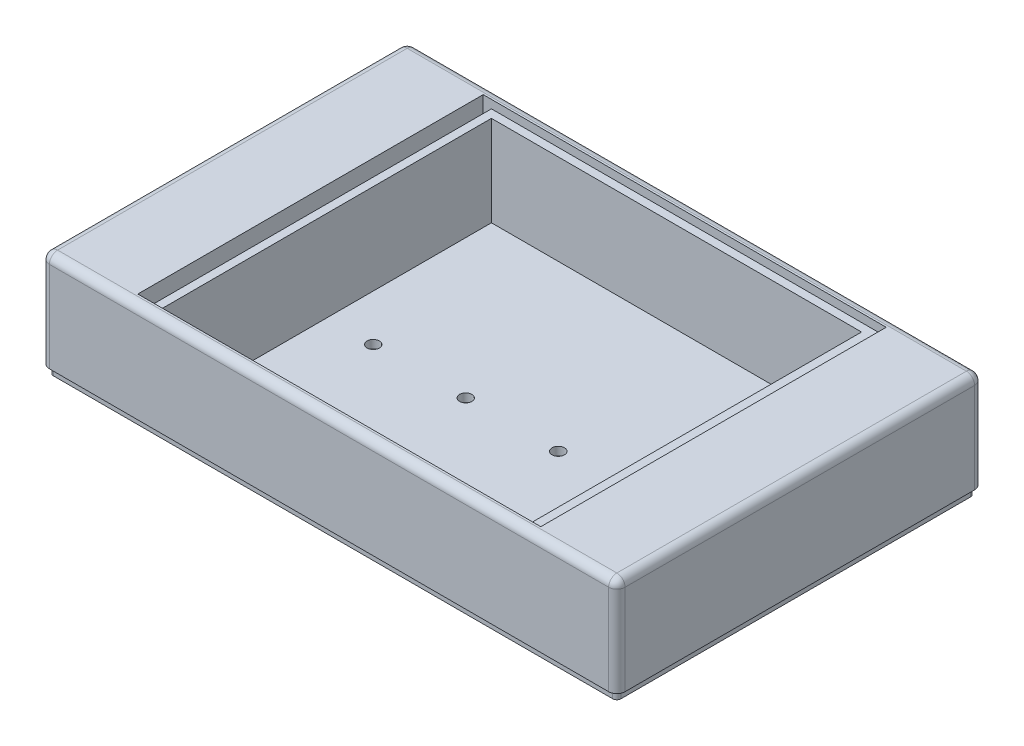
from build123d import *

# Parameters (mm, degrees)
BOSS_EXTRUDE1_DEPTH      = 16
BOSS_EXTRUDE1_DEPTH_BACK = 10
SKETCH1_W                = 140
SKETCH1_H                = 89
SKETCH2_W                = 94
SKETCH2_H                = 84
BOSS_EXTRUDE2_DEPTH      = 22
SKETCH3_W                = 90
SKETCH3_H                = 80
CUT_EXTRUDE2_DEPTH       = 24
SKETCH5_R                = 1.5
CUT_EXTRUDE4_DEPTH       = 2
FILLET1_R                = 2
FILLET2_R                = 2
CUT_EXTRUDE8_DEPTH       = 2
SKETCH10_W               = 5
SKETCH10_H               = 3
CUT_EXTRUDE9_DEPTH       = 3
SKETCH11_W               = 2
SKETCH11_H               = 84
CUT_EXTRUDE10_DEPTH      = 2
SHELL1_START             = -68
SHELL1_OUTLINE_W         = 20
SHELL1_OUTLINE_H         = 81
SHELL1_DEPTH             = 21
SHELL1_START_2           = 47
SHELL1_2_OUTLINE_W       = 20
SHELL1_2_OUTLINE_H       = 81
SHELL1_2_DEPTH           = 21
SHELL1_3_OUTLINE_W       = 4
SHELL1_3_OUTLINE_H       = 81
SHELL1_3_DEPTH           = 17
SHELL1_START_3           = 51
SHELL1_4_OUTLINE_W       = 4
SHELL1_4_OUTLINE_H       = 81
SHELL1_4_DEPTH           = 17
SKETCH7_OUTSIDE_W        = 175.584
SKETCH7_OUTSIDE_H        = 124.584
CUT_EXTRUDE6_DEPTH       = 2


# Read off the part's stored shape, not the designer's step: Shell1
with BuildPart() as part:
    # Sketch1 → Boss-Extrude1 (new, two sides: drawn at the far end of the back side and taken through both)
    with BuildSketch(Plane(origin=(0, 0, 0), x_dir=(1, 0, 0), z_dir=(0, 1, 0)).offset(-BOSS_EXTRUDE1_DEPTH_BACK)):
        Rectangle(SKETCH1_W, SKETCH1_H)
    extrude(amount=BOSS_EXTRUDE1_DEPTH + BOSS_EXTRUDE1_DEPTH_BACK)

    # Sketch2 → Boss-Extrude2 (add)
    with BuildSketch(Plane(origin=(0, 16, 0), x_dir=(1, 0, 0), z_dir=(0, 1, 0))):
        Rectangle(SKETCH2_W, SKETCH2_H)
    extrude(amount=-BOSS_EXTRUDE2_DEPTH)

    # Sketch3 → Cut-Extrude2 (cut)
    with BuildSketch(Plane(origin=(0, 16, 0), x_dir=(1, 0, 0), z_dir=(0, 1, 0))):
        Rectangle(SKETCH3_W, SKETCH3_H)
    extrude(amount=-CUT_EXTRUDE2_DEPTH, mode=Mode.SUBTRACT)

    # Sketch5 → Cut-Extrude4 (cut)
    with BuildSketch(Plane(origin=(0, -8, 0), x_dir=(1, 0, 0), z_dir=(0, 1, 0))):
        with Locations(Location((-33.75, 0, 0), (0, 0, 270))):
            Circle(SKETCH5_R)
        with Locations(Location((-11.25, 0, 0), (0, 0, 270))):
            Circle(SKETCH5_R)
        with Locations(Location((11.25, 0, 0), (0, 0, 270))):
            Circle(SKETCH5_R)
        with Locations(Location((33.75, 0, 0), (0, 0, 270))):
            Circle(SKETCH5_R)
    extrude(amount=-CUT_EXTRUDE4_DEPTH, mode=Mode.SUBTRACT)

    # Fillet1
    fillet1_edges = [part.edges().sort_by_distance(p)[0] for p in [
        (70, 3, 44.5),
        (-70, 3, 44.5),
        (-70, 3, -44.5),
        (70, 3, -44.5),
    ]]
    fillet(fillet1_edges, radius=FILLET1_R)

    # Fillet2
    fillet2_edges = [part.edges().sort_by_distance(p)[0] for p in [
        (-70, 16, 0),
        (70, 16, 0),
        (0, 16, -44.5),
        (0, 16, 44.5),
        (69.414213562, 16, 43.914213562),
        (69.414213562, 16, -43.914213562),
        (-69.414213562, 16, -43.914213562),
        (-69.414213562, 16, 43.914213562),
    ]]
    fillet(fillet2_edges, radius=FILLET2_R)

    # Sketch8 → Cut-Extrude8 (cut)
    with BuildSketch(Plane(origin=(0, 16, 0), x_dir=(1, 0, 0), z_dir=(0, 1, 0))):
        Polygon((-47, 42), (-49, 42), (-49, -42), (-47, -42), (47, -42), (49, -42), (49, 42), (47, 42), align=None)
    extrude(amount=-CUT_EXTRUDE8_DEPTH, mode=Mode.SUBTRACT)

    # Sketch10 → Cut-Extrude9 (cut)
    with BuildSketch(Plane(origin=(0, 0, 40), x_dir=(-1, 0, 0), z_dir=(0, 0, -1))):
        with Locations((-22.5, 10.5)):
            Rectangle(SKETCH10_W, SKETCH10_H)
        with Locations((22.5, 10.5)):
            Rectangle(SKETCH10_W, SKETCH10_H)
    extrude(amount=-CUT_EXTRUDE9_DEPTH, mode=Mode.SUBTRACT)

    # Sketch11 → Cut-Extrude10 (cut)
    with BuildSketch(Plane(origin=(0, 14, 0), x_dir=(1, 0, 0), z_dir=(0, 1, 0))):
        with Locations((-48, 0)):
            Rectangle(SKETCH11_W, SKETCH11_H)
        with Locations((48, 0)):
            Rectangle(SKETCH11_W, SKETCH11_H)
    extrude(amount=-CUT_EXTRUDE10_DEPTH, mode=Mode.SUBTRACT)

    # Shell1 outline → Shell1 (cut)
    with BuildSketch(Plane.YZ.offset(SHELL1_START)):
        Rectangle(SHELL1_OUTLINE_W, SHELL1_OUTLINE_H)
    extrude(amount=SHELL1_DEPTH, mode=Mode.SUBTRACT)

    # Shell1 2 outline → Shell1 2 (cut)
    with BuildSketch(Plane.YZ.offset(SHELL1_START_2)):
        Rectangle(SHELL1_2_OUTLINE_W, SHELL1_2_OUTLINE_H)
    extrude(amount=SHELL1_2_DEPTH, mode=Mode.SUBTRACT)

    # Shell1 3 outline → Shell1 3 (cut)
    with BuildSketch(Plane.YZ.offset(SHELL1_START)):
        with Locations((12, 0)):
            Rectangle(SHELL1_3_OUTLINE_W, SHELL1_3_OUTLINE_H)
    extrude(amount=SHELL1_3_DEPTH, mode=Mode.SUBTRACT)

    # Shell1 4 outline → Shell1 4 (cut)
    with BuildSketch(Plane.YZ.offset(SHELL1_START_3)):
        with Locations((12, 0)):
            Rectangle(SHELL1_4_OUTLINE_W, SHELL1_4_OUTLINE_H)
    extrude(amount=SHELL1_4_DEPTH, mode=Mode.SUBTRACT)

    # Sketch7 outside → Cut-Extrude6 (cut)
    with BuildSketch(Plane.XZ.offset(10)):
        Rectangle(SKETCH7_OUTSIDE_W, SKETCH7_OUTSIDE_H)
        with BuildLine():
            Line((-68, -43.5), (68, -43.5))
            ThreePointArc((68, -43.5), (68.707106781, -43.207106781), (69, -42.5))
            Line((69, -42.5), (69, 42.5))
            ThreePointArc((69, 42.5), (68.707106781, 43.207106781), (68, 43.5))
            Line((68, 43.5), (-68, 43.5))
            ThreePointArc((-68, 43.5), (-68.707106781, 43.207106781), (-69, 42.5))
            Line((-69, 42.5), (-69, -42.5))
            ThreePointArc((-69, -42.5), (-68.707106781, -43.207106781), (-68, -43.5))
        make_face(mode=Mode.SUBTRACT)
    extrude(amount=-CUT_EXTRUDE6_DEPTH, mode=Mode.SUBTRACT)


solid = part.part
